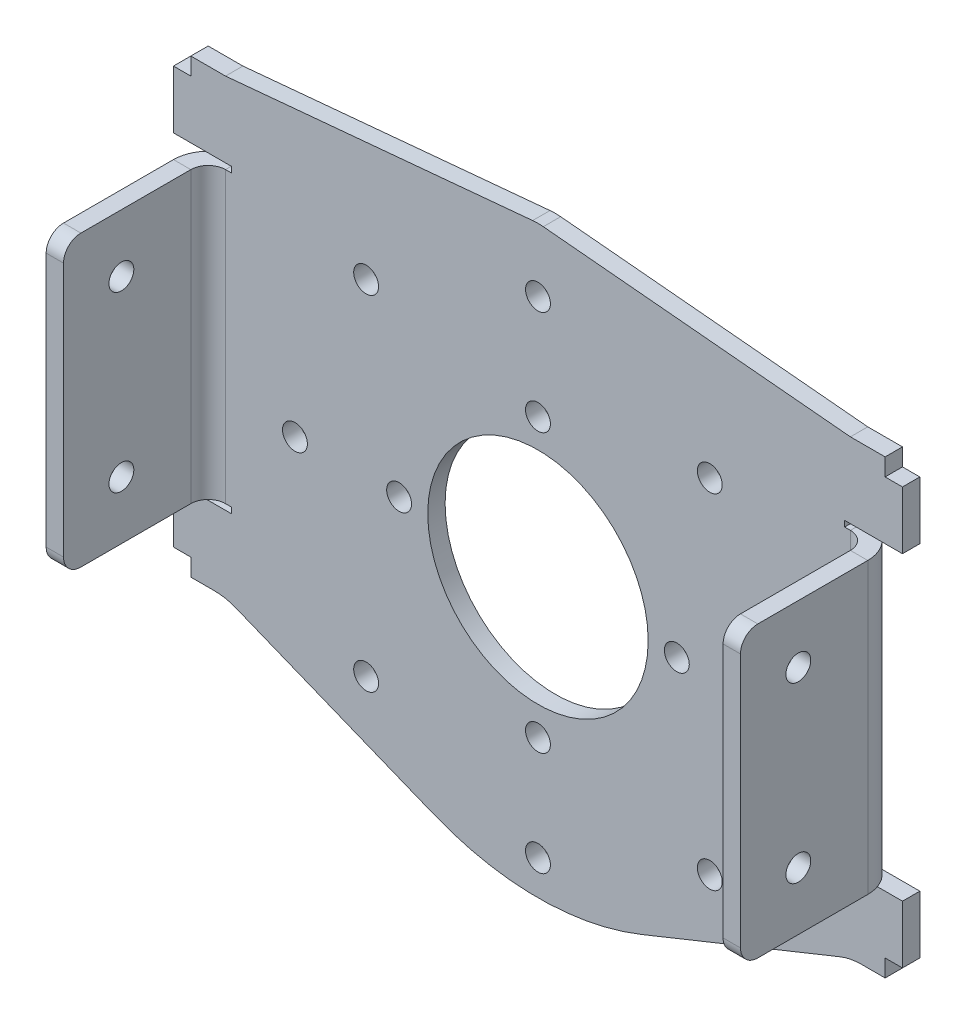
from build123d import *

# Parameters (mm, degrees)
SKETCH1_R                = 19.05
SKETCH1_R_2              = 1
BASE_FLANGE1_DEPTH       = 3
UP_DEPTH                 = 50
UP_START                 = -3
UP_PROFILE_W             = 50
UP_PROFILE_H             = 22
UP_PROFILE_R             = 1
UP_FLAT_DEPTH            = 3
M4_CLEARANCE_HOLE1_D     = 4.3
M4_CLEARANCE_HOLE1_DEPTH = 136
M4_CLEARANCE_HOLE1_TIP   = 1.291850331
M4_CLEARANCE_HOLE2_D     = 4.3
M4_CLEARANCE_HOLE2_DEPTH = 136
M4_CLEARANCE_HOLE2_TIP   = 1.291850331
FILLET1_R                = 10
FILLET2_R                = 3


# Sheet-metal steps are written as plain solids
with BuildPart() as part:
    # Sketch1 → Base-Flange1 (new body)
    with BuildSketch(Plane.XY):
        with BuildLine():
            Line((-54, -30), (-17.930398419, -44.525282846))
            ThreePointArc((-17.930398419, -44.525282846), (0, -48), (17.930398419, -44.525282846))
            Line((17.930398419, -44.525282846), (54, -30))
            Line((54, -30), (60, -30))
            Line((60, -30), (60, -27))
            Line((60, -27), (63, -27))
            Line((63, -27), (63, -17))
            Line((63, -17), (53, -17))
            Line((53, -17), (53, -16))
            Line((53, -16), (54, -16))
            Line((54, -16), (54, 34))
            Line((54, 34), (53, 34))
            Line((53, 34), (53, 35))
            Line((53, 35), (63, 35))
            Line((63, 35), (63, 45))
            Line((63, 45), (60, 45))
            Line((60, 45), (60, 48))
            Line((60, 48), (54, 48))
            Line((54, 48), (0, 53))
            Line((0, 53), (-54, 48))
            Line((-54, 48), (-60, 48))
            Line((-60, 48), (-60, 45))
            Line((-60, 45), (-63, 45))
            Line((-63, 45), (-63, 35))
            Line((-63, 35), (-53, 35))
            Line((-53, 35), (-53, 34))
            Line((-53, 34), (-54, 34))
            Line((-54, 34), (-54, -16))
            Line((-54, -16), (-53, -16))
            Line((-53, -16), (-53, -17))
            Line((-53, -17), (-63, -17))
            Line((-63, -17), (-63, -27))
            Line((-63, -27), (-60, -27))
            Line((-60, -27), (-60, -30))
            Line((-60, -30), (-54, -30))
        make_face()
        Circle(SKETCH1_R, mode=Mode.SUBTRACT)
        with Locations((0, 24)):
            Circle(SKETCH1_R_2, mode=Mode.SUBTRACT)
        with Locations((0, -42)):
            Circle(SKETCH1_R_2, mode=Mode.SUBTRACT)
        with Locations((-29.69848481, -29.69848481)):
            Circle(SKETCH1_R_2, mode=Mode.SUBTRACT)
        with Locations((-42, 0)):
            Circle(SKETCH1_R_2, mode=Mode.SUBTRACT)
        with Locations((-29.69848481, 29.69848481)):
            Circle(SKETCH1_R_2, mode=Mode.SUBTRACT)
        with Locations((0, 42)):
            Circle(SKETCH1_R_2, mode=Mode.SUBTRACT)
        with Locations((29.69848481, 29.69848481)):
            Circle(SKETCH1_R_2, mode=Mode.SUBTRACT)
        with Locations((42, 0)):
            Circle(SKETCH1_R_2, mode=Mode.SUBTRACT)
        with Locations((29.69848481, -29.69848481)):
            Circle(SKETCH1_R_2, mode=Mode.SUBTRACT)
        with Locations((24, 0)):
            Circle(SKETCH1_R_2, mode=Mode.SUBTRACT)
        with Locations((0, -24)):
            Circle(SKETCH1_R_2, mode=Mode.SUBTRACT)
        with Locations((-24, 0)):
            Circle(SKETCH1_R_2, mode=Mode.SUBTRACT)
    extrude(amount=-BASE_FLANGE1_DEPTH)

    # UP bend section (across the edge) → UP (add)
    with BuildSketch(Plane(origin=(-57, 34, 0), x_dir=(1, 0, 0), z_dir=(0, -1, 0))):
        with BuildLine():
            Line((-3, 3), (0, 3))
            ThreePointArc((0, 3), (0.878679656, 0.878679656), (3, 0))
            Line((3, 0), (3, -3))
            ThreePointArc((3, -3), (-1.242640687, -1.242640687), (-3, 3))
        make_face()
    up = extrude(amount=UP_DEPTH)

    # UP profile (on flange) → UP flat (add)
    with BuildSketch(Plane.YZ.offset(-57).offset(UP_START)):
        with Locations((9, 14)):
            Rectangle(UP_PROFILE_W, UP_PROFILE_H)
        with Locations((-6, 15)):
            Circle(UP_PROFILE_R, mode=Mode.SUBTRACT)
        with Locations((24, 15)):
            Circle(UP_PROFILE_R, mode=Mode.SUBTRACT)
    up_flat = extrude(amount=UP_FLAT_DEPTH)

    # Mirror1: UP, UP flat across plane
    add(up.mirror(Plane(origin=(0, 0, 0), x_dir=(0, 0, 1), z_dir=(1, 0, 0))))
    add(up_flat.mirror(Plane(origin=(0, 0, 0), x_dir=(0, 0, 1), z_dir=(1, 0, 0))))

    # M4 Clearance Hole1
    with Locations(Plane.XY):
        with Locations((0, 24), (24, 0), (-24, 0), (0, -24), (0, -42), (29.69848481, -29.69848481), (42, 0), (29.69848481, 29.69848481), (0, 42), (-29.69848481, 29.69848481), (-42, 0), (-29.69848481, -29.69848481)):
            Hole(M4_CLEARANCE_HOLE1_D / 2, depth=M4_CLEARANCE_HOLE1_DEPTH)
            with Locations((0, 0, -(M4_CLEARANCE_HOLE1_DEPTH + M4_CLEARANCE_HOLE1_TIP / 2))):  # 118° drill point
                Cone(0, M4_CLEARANCE_HOLE1_D / 2, M4_CLEARANCE_HOLE1_TIP, mode=Mode.SUBTRACT)

    # M4 Clearance Hole2
    with Locations(Plane.ZY.offset(60)):
        with Locations((15, 24), (15, -6)):
            Hole(M4_CLEARANCE_HOLE2_D / 2, depth=M4_CLEARANCE_HOLE2_DEPTH)
            with Locations((0, 0, -(M4_CLEARANCE_HOLE2_DEPTH + M4_CLEARANCE_HOLE2_TIP / 2))):  # 118° drill point
                Cone(0, M4_CLEARANCE_HOLE2_D / 2, M4_CLEARANCE_HOLE2_TIP, mode=Mode.SUBTRACT)

    # Fillet1
    fillet1_edges = [part.edges().sort_by_distance(p)[0] for p in [
        (0, 53, -1.5),
        (54, -30, -1.5),
        (-54, -30, -1.5),
    ]]
    fillet(fillet1_edges, radius=FILLET1_R)

    # Fillet2
    fillet2_edges = [part.edges().sort_by_distance(p)[0] for p in [
        (-58.5, 34, 25),
        (-58.5, -16, 25),
        (58.5, -16, 25),
        (58.5, 34, 25),
    ]]
    fillet(fillet2_edges, radius=FILLET2_R)


solid = part.part
